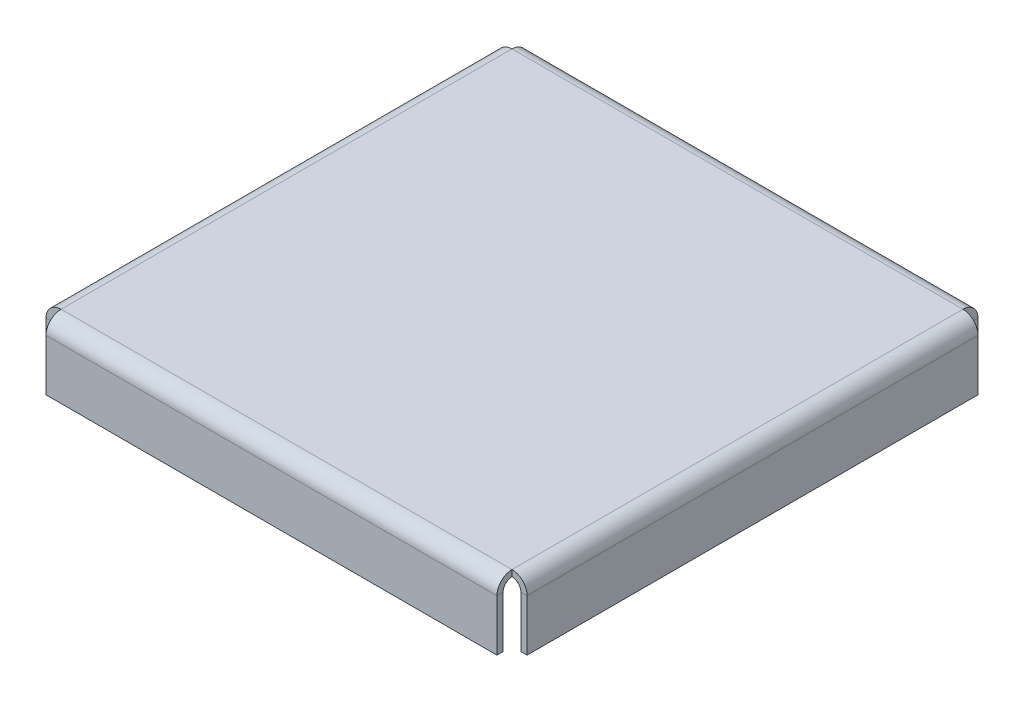
from build123d import *

# Parameters (mm, degrees)
SKETCH1_W          = 50.8
SKETCH1_H          = 50.8
BASE_FLANGE1_DEPTH = 0.7
EDGE_FLANGE1_DEPTH = 50.8
EDGE_FLANGE2_DEPTH = 50.8
EDGE_FLANGE3_DEPTH = 50.8
EDGE_FLANGE4_DEPTH = 50.8


# Sheet-metal steps are written as plain solids
with BuildPart() as part:
    # Sketch1 → Base-Flange1 (new body)
    with BuildSketch(Plane(origin=(0, 0, 0), x_dir=(1, 0, 0), z_dir=(0, 1, 0))):
        Rectangle(SKETCH1_W, SKETCH1_H)
    extrude(amount=-BASE_FLANGE1_DEPTH)

    # Edge-Flange1 section (across the edge) → Edge-Flange1 (add)
    with BuildSketch(Plane(origin=(26.4, -0.7, -25.4), x_dir=(-1, 0, 0), z_dir=(0, 0, 1))):
        with BuildLine():
            Line((-0.7, 1), (-0.7, 6.8))
            Line((-0.7, 6.8), (0, 6.8))
            Line((0, 6.8), (0, 1))
            ThreePointArc((0, 1), (0.292893219, 0.292893219), (1, 0))
            Line((1, 0), (1, -0.7))
            ThreePointArc((1, -0.7), (-0.202081528, -0.202081528), (-0.7, 1))
        make_face()
    extrude(amount=EDGE_FLANGE1_DEPTH)

    # Edge-Flange2 section (across the edge) → Edge-Flange2 (add)
    with BuildSketch(Plane(origin=(25.4, -0.7, 26.4), x_dir=(0, 0, -1), z_dir=(-1, 0, 0))):
        with BuildLine():
            Line((-0.7, 1), (-0.7, 6.8))
            Line((-0.7, 6.8), (0, 6.8))
            Line((0, 6.8), (0, 1))
            ThreePointArc((0, 1), (0.292893219, 0.292893219), (1, 0))
            Line((1, 0), (1, -0.7))
            ThreePointArc((1, -0.7), (-0.202081528, -0.202081528), (-0.7, 1))
        make_face()
    extrude(amount=EDGE_FLANGE2_DEPTH)

    # Edge-Flange3 section (across the edge) → Edge-Flange3 (add)
    with BuildSketch(Plane(origin=(-26.4, -0.7, 25.4), x_dir=(1, 0, 0), z_dir=(0, 0, -1))):
        with BuildLine():
            Line((-0.7, 1), (-0.7, 6.8))
            Line((-0.7, 6.8), (0, 6.8))
            Line((0, 6.8), (0, 1))
            ThreePointArc((0, 1), (0.292893219, 0.292893219), (1, 0))
            Line((1, 0), (1, -0.7))
            ThreePointArc((1, -0.7), (-0.202081528, -0.202081528), (-0.7, 1))
        make_face()
    extrude(amount=EDGE_FLANGE3_DEPTH)

    # Edge-Flange4 section (across the edge) → Edge-Flange4 (add)
    with BuildSketch(Plane(origin=(-25.4, -0.7, -26.4), x_dir=(0, 0, 1), z_dir=(1, 0, 0))):
        with BuildLine():
            Line((-0.7, 1), (-0.7, 6.8))
            Line((-0.7, 6.8), (0, 6.8))
            Line((0, 6.8), (0, 1))
            ThreePointArc((0, 1), (0.292893219, 0.292893219), (1, 0))
            Line((1, 0), (1, -0.7))
            ThreePointArc((1, -0.7), (-0.202081528, -0.202081528), (-0.7, 1))
        make_face()
    extrude(amount=EDGE_FLANGE4_DEPTH)


solid = part.part
